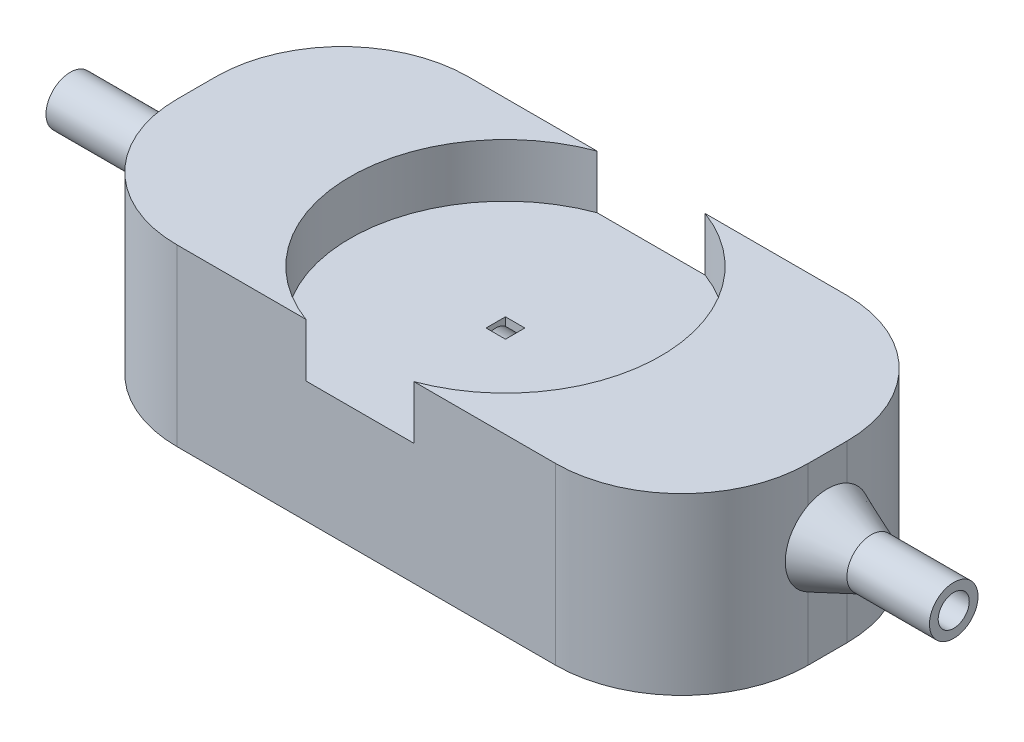
from build123d import *

# Parameters (mm, degrees)
SKETCH1_W           = 65
SKETCH1_H           = 30
BOSS_EXTRUDE1_DEPTH = 58
FILLET1_R           = 13
SKETCH15_W          = 83.696095513
SKETCH15_H          = 31.69844841
CUT_EXTRUDE7_DEPTH  = 50
SKETCH18_R          = 16
CUT_EXTRUDE10_DEPTH = 5.5
CUT_EXTRUDE12_REACH = 90.397
SKETCH3_R           = 1.6
SKETCH21_W          = 2
SKETCH21_H          = 2
CUT_EXTRUDE13_DEPTH = 8


with BuildPart() as part:
    # Sketch1 → Boss-Extrude1 (new body)
    with BuildSketch(Plane(origin=(0, 0, 0), x_dir=(1, 0, 0), z_dir=(0, 1, 0))):
        with Locations((7.5, 0)):
            Rectangle(SKETCH1_W, SKETCH1_H)
    extrude(amount=BOSS_EXTRUDE1_DEPTH)

    # Fillet1
    fillet1_edges = [part.edges().sort_by_distance(p)[0] for p in [
        (40, 29, -15),
        (-25, 29, -15),
        (40, 29, 15),
        (-25, 29, 15),
    ]]
    fillet(fillet1_edges, radius=FILLET1_R)

    # Sketch15 → Cut-Extrude7 (cut)
    with BuildSketch(Plane(origin=(0, -10, 0), x_dir=(-1, 0, 0), z_dir=(0, -1, 0))):
        with Locations((-0.057440767, 0.030479277)):
            Rectangle(SKETCH15_W, SKETCH15_H)
    extrude(amount=-CUT_EXTRUDE7_DEPTH, mode=Mode.SUBTRACT)

    # Sketch18 → Cut-Extrude10 (cut)
    with BuildSketch(Plane(origin=(0, 58, 0), x_dir=(1, 0, 0), z_dir=(0, 1, 0))):
        with Locations((6.828508286, 0)):
            Circle(SKETCH18_R)
    extrude(amount=-CUT_EXTRUDE10_DEPTH, mode=Mode.SUBTRACT)

    # Sketch3 → Cut-Extrude12 (cut, up to next)
    with BuildSketch(Plane.ZY.offset(25), mode=Mode.PRIVATE) as cut_extrude12_sk1:
        with Locations((0, 50.4)):
            Circle(SKETCH3_R)
    cut_extrude12_tool1 = extrude(cut_extrude12_sk1.sketch, amount=-CUT_EXTRUDE12_REACH, mode=Mode.PRIVATE) & part.part
    add(cut_extrude12_tool1.solids().sort_by_distance((-25, 50.4, 0))[0], mode=Mode.SUBTRACT)

    # Sketch21 → Cut-Extrude13 (cut)
    with BuildSketch(Plane(origin=(0, 52.5, 0), x_dir=(1, 0, 0), z_dir=(0, 1, 0))):
        with Locations((6.828508286, 0)):
            Rectangle(SKETCH21_W, SKETCH21_H)
    extrude(amount=-CUT_EXTRUDE13_DEPTH, mode=Mode.SUBTRACT)

    # Sketch24 → Revolve1 (revolve)
    with BuildSketch(Plane.XY):
        Polygon((-25, 52), (-38, 52), (-38, 52.9), (-29.5, 52.9), (-25, 54.749890762), align=None)
    revolve(axis=Axis((-25, 50.4, 0), (-1, 0, 0)))

    # Sketch25 → Revolve2 (revolve)
    with BuildSketch(Plane.XY):
        Polygon((40, 51.99856611), (40, 54.74856611), (44.5, 52.89856611), (53, 52.89856611), (53, 51.99856611), align=None)
    revolve(axis=Axis((50.482197819, 50.39856611, 0), (-1, 0, 0)))


solid = part.part
